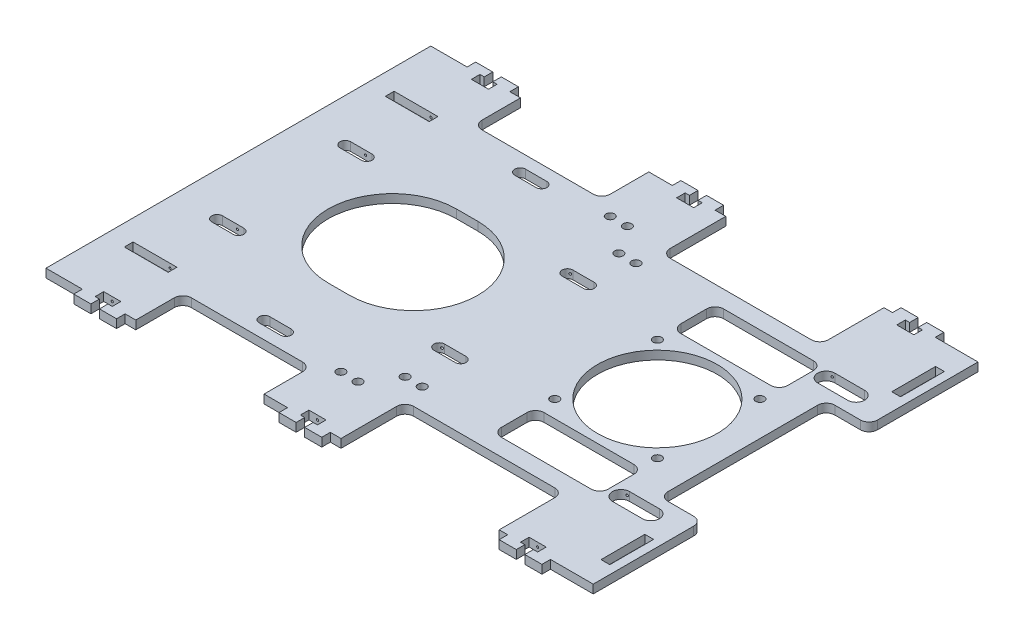
from build123d import *

# Parameters (mm, degrees)
SKETCH_1_R             = 28
SKETCH_1_R_2           = 2
SKETCH_1_W             = 20.5
SKETCH_1_H             = 4.1
SKETCH_1_W_2           = 4.1
SKETCH_1_H_2           = 20.5
SM_BASE_FLANGE_1_DEPTH = 4
SKETCH_2_R             = 0.5
CUT_EXTRUDE_3_DEPTH    = 316.290342383


# Sheet-metal steps are written as plain solids
with BuildPart() as part:
    # Sketch 1 → Базовая кромка1 (new body)
    with BuildSketch(Plane(origin=(0, 0, 0), x_dir=(1, 0, 0), z_dir=(0, 1, 0))):
        with BuildLine():
            Line((0, 0), (17, 0))
            Line((17, 0), (17, 4))
            Line((17, 4), (25, 4))
            Line((25, 4), (25, 0))
            Line((25, 0), (23, 0))
            Line((23, 0), (23, -4))
            Line((23, -4), (31, -4))
            Line((31, -4), (31, 0))
            Line((31, 0), (29, 0))
            Line((29, 0), (29, 4))
            Line((29, 4), (37, 4))
            Line((37, 4), (37, 0))
            Line((37, 0), (42, 0))
            Line((42, 0), (42, -18))
            ThreePointArc((42, -18), (43.171572875, -20.828427125), (46, -22))
            Line((46, -22), (98, -22))
            ThreePointArc((98, -22), (100.828427125, -20.828427125), (102, -18))
            Line((102, -18), (102, 0))
            Line((102, 0), (113, 0))
            Line((113, 0), (113, 4))
            Line((113, 4), (121, 4))
            Line((121, 4), (121, 0))
            Line((121, 0), (119, 0))
            Line((119, 0), (119, -4))
            Line((119, -4), (127, -4))
            Line((127, -4), (127, 0))
            Line((127, 0), (125, 0))
            Line((125, 0), (125, 4))
            Line((125, 4), (133, 4))
            Line((133, 4), (133, 0))
            Line((133, 0), (138, 0))
            Line((138, 0), (138, -26))
            ThreePointArc((138, -26), (139.171572875, -28.828427125), (142, -30))
            Line((142, -30), (208, -30))
            ThreePointArc((208, -30), (210.828427125, -28.828427125), (212, -26))
            Line((212, -26), (212, 0))
            Line((212, 0), (216, 0))
            Line((216, 0), (216, 4))
            Line((216, 4), (224, 4))
            Line((224, 4), (224, 0))
            Line((224, 0), (222, 0))
            Line((222, 0), (222, -4))
            Line((222, -4), (230, -4))
            Line((230, -4), (230, 0))
            Line((230, 0), (228, 0))
            Line((228, 0), (228, 4))
            Line((228, 4), (236, 4))
            Line((236, 4), (236, 0))
            Line((236, 0), (256, 0))
            Line((256, 0), (256, -47))
            ThreePointArc((256, -47), (254.828427125, -49.828427125), (252, -51))
            Line((252, -51), (240, -51))
            ThreePointArc((240, -51), (237.171572875, -52.171572875), (236, -55))
            Line((236, -55), (236, -125))
            ThreePointArc((236, -125), (237.171572875, -127.828427125), (240, -129))
            Line((240, -129), (252, -129))
            ThreePointArc((252, -129), (254.828427125, -130.171572875), (256, -133))
            Line((256, -133), (256, -180))
            Line((256, -180), (236, -180))
            Line((236, -180), (236, -184))
            Line((236, -184), (228, -184))
            Line((228, -184), (228, -180))
            Line((228, -180), (230, -180))
            Line((230, -180), (230, -176))
            Line((230, -176), (222, -176))
            Line((222, -176), (222, -180))
            Line((222, -180), (224, -180))
            Line((224, -180), (224, -184))
            Line((224, -184), (216, -184))
            Line((216, -184), (216, -180))
            Line((216, -180), (212, -180))
            Line((212, -180), (212, -154))
            ThreePointArc((212, -154), (210.828427125, -151.171572875), (208, -150))
            Line((208, -150), (142, -150))
            ThreePointArc((142, -150), (139.171572875, -151.171572875), (138, -154))
            Line((138, -154), (138, -180))
            Line((138, -180), (133, -180))
            Line((133, -180), (133, -184))
            Line((133, -184), (125, -184))
            Line((125, -184), (125, -180))
            Line((125, -180), (127, -180))
            Line((127, -180), (127, -176))
            Line((127, -176), (119, -176))
            Line((119, -176), (119, -180))
            Line((119, -180), (121, -180))
            Line((121, -180), (121, -184))
            Line((121, -184), (113, -184))
            Line((113, -184), (113, -180))
            Line((113, -180), (102, -180))
            Line((102, -180), (102, -162))
            ThreePointArc((102, -162), (100.828427125, -159.171572875), (98, -158))
            Line((98, -158), (46, -158))
            ThreePointArc((46, -158), (43.171572875, -159.171572875), (42, -162))
            Line((42, -162), (42, -180))
            Line((42, -180), (37, -180))
            Line((37, -180), (37, -184))
            Line((37, -184), (29, -184))
            Line((29, -184), (29, -180))
            Line((29, -180), (31, -180))
            Line((31, -180), (31, -176))
            Line((31, -176), (23, -176))
            Line((23, -176), (23, -180))
            Line((23, -180), (25, -180))
            Line((25, -180), (25, -184))
            Line((25, -184), (17, -184))
            Line((17, -184), (17, -180))
            Line((17, -180), (0, -180))
            Line((0, -180), (0, -140))
            Line((0, -140), (0, -40))
            Line((0, -40), (0, 0))
        make_face()
        with Locations(Location((196, -90, 0), (0, 0, 270))):
            Circle(SKETCH_1_R, mode=Mode.SUBTRACT)
        with Locations(Location((172, -66, 0), (0, 0, 270))):
            Circle(SKETCH_1_R_2, mode=Mode.SUBTRACT)
        with Locations(Location((220, -66, 0), (0, 0, 270))):
            Circle(SKETCH_1_R_2, mode=Mode.SUBTRACT)
        with Locations(Location((220, -114, 0), (0, 0, 270))):
            Circle(SKETCH_1_R_2, mode=Mode.SUBTRACT)
        with Locations(Location((172, -114, 0), (0, 0, 270))):
            Circle(SKETCH_1_R_2, mode=Mode.SUBTRACT)
        with Locations(Location((128, -140, 0), (0, 0, 270))):
            Circle(SKETCH_1_R_2, mode=Mode.SUBTRACT)
        with Locations(Location((136, -140, 0), (0, 0, 270))):
            Circle(SKETCH_1_R_2, mode=Mode.SUBTRACT)
        with Locations(Location((136, -40, 0), (0, 0, 90))):
            Circle(SKETCH_1_R_2, mode=Mode.SUBTRACT)
        with Locations(Location((128, -40, 0), (0, 0, 90))):
            Circle(SKETCH_1_R_2, mode=Mode.SUBTRACT)
        with Locations(Location((110.961524227, -153, 0), (0, 0, 270))):
            Circle(SKETCH_1_R_2, mode=Mode.SUBTRACT)
        with Locations(Location((118.961524227, -153, 0), (0, 0, 270))):
            Circle(SKETCH_1_R_2, mode=Mode.SUBTRACT)
        with Locations(Location((118.961524227, -27, 0), (0, 0, 90))):
            Circle(SKETCH_1_R_2, mode=Mode.SUBTRACT)
        with Locations(Location((110.961524227, -27, 0), (0, 0, 90))):
            Circle(SKETCH_1_R_2, mode=Mode.SUBTRACT)
        with Locations((20, -151.05)):
            Rectangle(SKETCH_1_W, SKETCH_1_H, mode=Mode.SUBTRACT)
        with Locations((20, -28.95)):
            Rectangle(SKETCH_1_W, SKETCH_1_H, mode=Mode.SUBTRACT)
        with BuildLine():
            Line((72, -60), (82, -60))
            ThreePointArc((82, -60), (112, -90), (82, -120))
            Line((82, -120), (72, -120))
            ThreePointArc((72, -120), (42, -90), (72, -60))
        make_face(mode=Mode.SUBTRACT)
        with BuildLine():
            Line((20.038475773, -57.5), (30.038475773, -57.5))
            ThreePointArc((30.038475773, -57.5), (32.538475773, -60), (30.038475773, -62.5))
            Line((30.038475773, -62.5), (20.038475773, -62.5))
            ThreePointArc((20.038475773, -62.5), (17.538475773, -60), (20.038475773, -57.5))
        make_face(mode=Mode.SUBTRACT)
        with BuildLine():
            Line((133.959888942, -57.4967321), (123.959891078, -57.503268968))
            ThreePointArc((123.959891078, -57.503268968), (121.461525829, -60.004902651), (123.963159512, -62.5032679))
            Line((123.963159512, -62.5032679), (133.963157376, -62.496731032))
            ThreePointArc((133.963157376, -62.496731032), (136.461522625, -59.995097349), (133.959888942, -57.4967321))
        make_face(mode=Mode.SUBTRACT)
        with BuildLine():
            Line((20.038475773, -122.5), (30.038475773, -122.5))
            ThreePointArc((30.038475773, -122.5), (32.538475773, -120), (30.038475773, -117.5))
            Line((30.038475773, -117.5), (20.038475773, -117.5))
            ThreePointArc((20.038475773, -117.5), (17.538475773, -120), (20.038475773, -122.5))
        make_face(mode=Mode.SUBTRACT)
        with BuildLine():
            Line((133.961524227, -122.5), (123.961524227, -122.5))
            ThreePointArc((123.961524227, -122.5), (121.461524227, -120), (123.961524227, -117.5))
            Line((123.961524227, -117.5), (133.961524227, -117.5))
            ThreePointArc((133.961524227, -117.5), (136.461524227, -120), (133.961524227, -122.5))
        make_face(mode=Mode.SUBTRACT)
        with BuildLine():
            Line((82, -32.708696284), (72, -32.708696284))
            ThreePointArc((72, -32.708696284), (69.5, -30.208696284), (72, -27.708696284))
            Line((72, -27.708696284), (82, -27.708696284))
            ThreePointArc((82, -27.708696284), (84.5, -30.208696284), (82, -32.708696284))
        make_face(mode=Mode.SUBTRACT)
        with BuildLine():
            Line((82, -147.291303716), (72, -147.291303716))
            ThreePointArc((72, -147.291303716), (69.5, -149.791303716), (72, -152.291303716))
            Line((72, -152.291303716), (82, -152.291303716))
            ThreePointArc((82, -152.291303716), (84.5, -149.791303716), (82, -147.291303716))
        make_face(mode=Mode.SUBTRACT)
        with BuildLine():
            Line((221, -138.0000162), (221, -126))
            ThreePointArc((221, -126), (219.828427125, -123.171572875), (217, -122))
            Line((217, -122), (175, -122))
            ThreePointArc((175, -122), (172.171578295, -123.171567456), (171, -125.999984671))
            Line((171, -125.999984671), (171, -138))
            ThreePointArc((171, -138), (172.171572875, -140.828427125), (175, -142))
            Line((175, -142), (217.011384277, -142))
            ThreePointArc((217.011384277, -142), (219.832449215, -140.824415508), (221, -138.0000162))
        make_face(mode=Mode.SUBTRACT)
        with BuildLine():
            Line((175, -38), (217, -38))
            ThreePointArc((217, -38), (219.828427125, -39.171572875), (221, -42))
            Line((221, -42), (221, -54))
            ThreePointArc((221, -54), (219.828427125, -56.828427125), (217, -58))
            Line((217, -58), (175, -58))
            ThreePointArc((175, -58), (172.171572875, -56.828427125), (171, -54))
            Line((171, -54), (171, -42))
            ThreePointArc((171, -42), (172.171572875, -39.171572875), (175, -38))
        make_face(mode=Mode.SUBTRACT)
        with BuildLine():
            Line((227, -38), (241, -38))
            ThreePointArc((241, -38), (245, -42), (241, -46))
            Line((241, -46), (227, -46))
            ThreePointArc((227, -46), (223, -42), (227, -38))
        make_face(mode=Mode.SUBTRACT)
        with BuildLine():
            Line((227, -142), (241, -142))
            ThreePointArc((241, -142), (245, -138), (241, -134))
            Line((241, -134), (227, -134))
            ThreePointArc((227, -134), (223, -138), (227, -142))
        make_face(mode=Mode.SUBTRACT)
        with Locations((249.95, -158)):
            Rectangle(SKETCH_1_W_2, SKETCH_1_H_2, mode=Mode.SUBTRACT)
        with Locations((249.95, -22)):
            Rectangle(SKETCH_1_W_2, SKETCH_1_H_2, mode=Mode.SUBTRACT)
    extrude(amount=-SM_BASE_FLANGE_1_DEPTH)

    # Sketch 2 → Вырез-Вытянуть3 (cut, through all)
    with BuildSketch(Plane.XY.offset(180)):
        with Locations((27, -2)):
            Circle(SKETCH_2_R)
        with Locations((123, -2)):
            Circle(SKETCH_2_R)
        with Locations((226, -2)):
            Circle(SKETCH_2_R)
    extrude(amount=-CUT_EXTRUDE_3_DEPTH, mode=Mode.SUBTRACT)


solid = part.part
